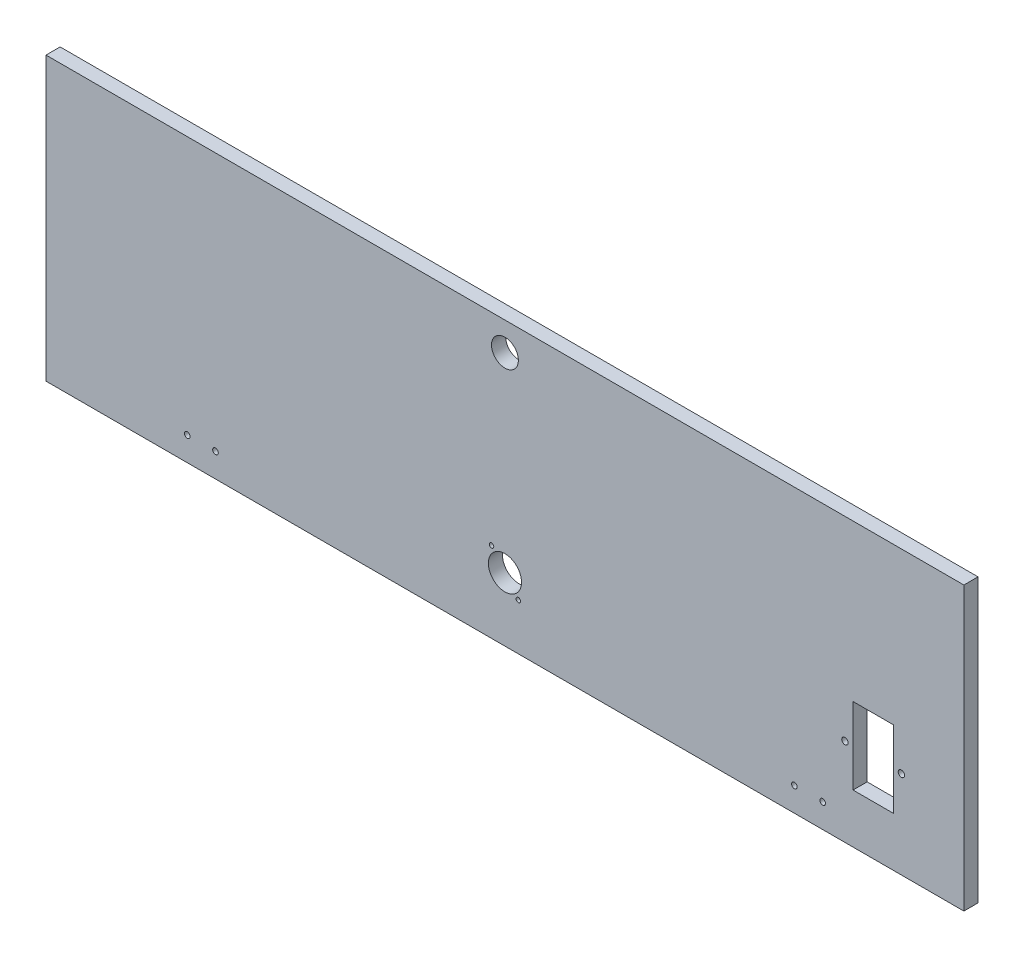
from build123d import *

# Parameters (mm, degrees)
ESQUISSE1_W             = 650
ESQUISSE1_H             = 200
BOSS_EXTRU_1_DEPTH      = 10
ESQUISSE2_R             = 2
ENL_V_MAT_EXTRU_1_DEPTH = 10
ESQUISSE3_R             = 1.6
ESQUISSE3_R_2           = 11.75
ESQUISSE3_W             = 28.5
ESQUISSE3_H             = 54.3
ESQUISSE3_R_3           = 2.25
ENL_V_MAT_EXTRU_2_DEPTH = 10
ESQUISSE4_R             = 9.5
ENL_V_MAT_EXTRU_3_DEPTH = 10
ESQUISSE5_R             = 1.5
ENL_V_MAT_EXTRU_4_DEPTH = 2


with BuildPart() as part:
    # Esquisse1 → Boss.-Extru.1 (new body)
    with BuildSketch(Plane.XY):
        with Locations((325, 100)):
            Rectangle(ESQUISSE1_W, ESQUISSE1_H)
    extrude(amount=BOSS_EXTRU_1_DEPTH)

    # Esquisse2 → Enlèv. mat.-Extru.1 (cut)
    with BuildSketch(Plane.XY.offset(10)):
        with Locations((100, 17)):
            Circle(ESQUISSE2_R)
        with Locations((120, 17)):
            Circle(ESQUISSE2_R)
        with Locations((530, 17)):
            Circle(ESQUISSE2_R)
        with Locations((550, 17)):
            Circle(ESQUISSE2_R)
    extrude(amount=-ENL_V_MAT_EXTRU_1_DEPTH, mode=Mode.SUBTRACT)

    # Esquisse3 → Enlèv. mat.-Extru.2 (cut)
    with BuildSketch(Plane.XY.offset(10)):
        with Locations((315.499614794, 56.999404399)):
            Circle(ESQUISSE3_R)
        with Locations((325, 45)):
            Circle(ESQUISSE3_R_2)
        with Locations((334.500385206, 33.000595601)):
            Circle(ESQUISSE3_R)
        with Locations((585.75, 62.15)):
            Rectangle(ESQUISSE3_W, ESQUISSE3_H)
        with Locations((565.75, 62.15)):
            Circle(ESQUISSE3_R_3)
        with Locations((605.75, 62.15)):
            Circle(ESQUISSE3_R_3)
    extrude(amount=-ENL_V_MAT_EXTRU_2_DEPTH, mode=Mode.SUBTRACT)

    # Esquisse4 → Enlèv. mat.-Extru.3 (cut)
    with BuildSketch(Plane.XY.offset(10)):
        with Locations((325, 180)):
            Circle(ESQUISSE4_R)
    extrude(amount=-ENL_V_MAT_EXTRU_3_DEPTH, mode=Mode.SUBTRACT)

    # Esquisse5 → Enlèv. mat.-Extru.4 (cut)
    with BuildSketch(Plane.XY):
        with Locations((341, 180)):
            Circle(ESQUISSE5_R)
        with Locations((309, 180)):
            Circle(ESQUISSE5_R)
    extrude(amount=ENL_V_MAT_EXTRU_4_DEPTH, mode=Mode.SUBTRACT)


solid = part.part
